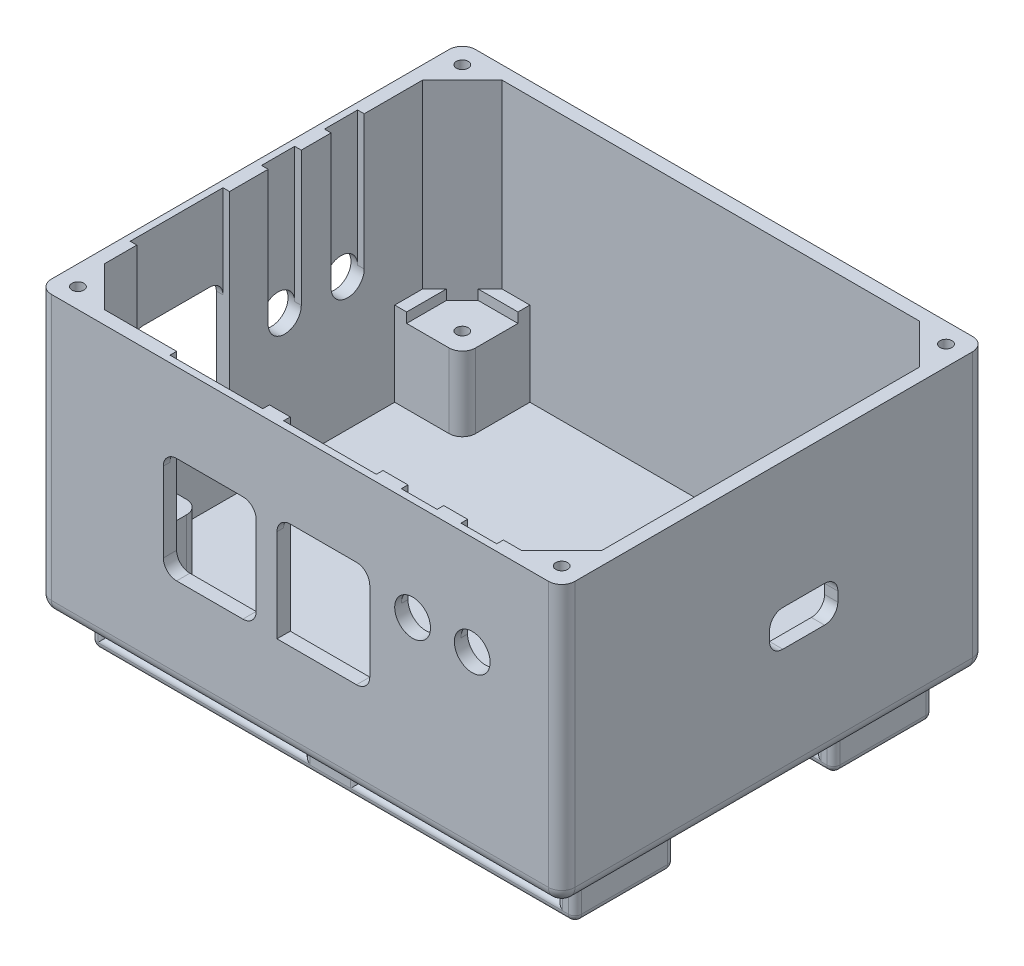
from build123d import *

# Parameters (mm, degrees)
SKETCH1_W           = 79
SKETCH1_H           = 64
BOSS_EXTRUDE1_DEPTH = 2
SKETCH2_W           = 79
SKETCH2_H           = 64
SKETCH2_W_2         = 75
SKETCH2_H_2         = 60
BOSS_EXTRUDE2_DEPTH = 40
BOSS_EXTRUDE3_DEPTH = 40
SKETCH3_R           = 0.9
CUT_EXTRUDE2_DEPTH  = 10
SKETCH5_W           = 14
SKETCH5_H           = 1
SKETCH5_W_2         = 1
SKETCH5_H_2         = 14
CUT_EXTRUDE3_DEPTH  = 28
SKETCH6_W           = 14
SKETCH6_H           = 16
CUT_EXTRUDE4_DEPTH  = 2
SKETCH7_W           = 14
SKETCH7_H           = 16
CUT_EXTRUDE5_DEPTH  = 2
CUT_EXTRUDE7_DEPTH  = 1
SKETCH10_R          = 2.5
CUT_EXTRUDE8_DEPTH  = 3
SKETCH11_R          = 2.7
CUT_EXTRUDE9_DEPTH  = 3
SKETCH12_W          = 5.4
SKETCH12_H          = 15
CUT_EXTRUDE10_DEPTH = 1
SKETCH13_W          = 10.3
SKETCH13_H          = 5.45
CUT_EXTRUDE11_DEPTH = 2
FILLET1_R           = 2
FILLET2_R           = 2
FILLET3_R           = 2
FILLET4_R           = 2
FILLET5_R           = 2
FILLET6_R           = 2
FILLET7_R           = 2
FILLET8_R           = 2
FILLET9_R           = 2
FILLET10_R          = 2
FILLET11_R          = 2
FILLET12_R          = 2
FILLET13_R          = 2
FILLET14_R          = 2
FILLET15_R          = 2
FILLET16_R          = 2
FILLET17_R          = 2
FILLET18_R          = 2
FILLET19_R          = 2
SKETCH14_W          = 10.2
SKETCH14_H          = 10.2
SKETCH14_W_2        = 9.2
BOSS_EXTRUDE5_DEPTH = 11.2
SKETCH15_R          = 0.9
CUT_EXTRUDE12_DEPTH = 10
BOSS_EXTRUDE6_DEPTH = 1.5
FILLET20_R          = 2
FILLET21_R          = 2
FILLET22_R          = 2
FILLET23_R          = 2
BOSS_EXTRUDE7_DEPTH = 6
SKETCH20_W          = 30
SKETCH20_H          = 4
CUT_EXTRUDE13_DEPTH = 58
FILLET37_R          = 1
FILLET39_R          = 1
FILLET42_R          = 1
FILLET43_R          = 1
FILLET44_R          = 1
FILLET45_R          = 1


# Some blends are built 0.0001 mm under size
with BuildPart() as part:
    # Sketch1 → Boss-Extrude1 (new body)
    with BuildSketch(Plane(origin=(0, 0, 0), x_dir=(1, 0, 0), z_dir=(0, 1, 0))):
        Rectangle(SKETCH1_W, SKETCH1_H)
    extrude(amount=BOSS_EXTRUDE1_DEPTH)

    # Sketch2 → Boss-Extrude2 (add)
    with BuildSketch(Plane(origin=(0, 2, 0), x_dir=(1, 0, 0), z_dir=(0, 1, 0))):
        Rectangle(SKETCH2_W, SKETCH2_H)
        Rectangle(SKETCH2_W_2, SKETCH2_H_2, mode=Mode.SUBTRACT)
    extrude(amount=BOSS_EXTRUDE2_DEPTH)

    # Sketch4 → Boss-Extrude3 (add)
    with BuildSketch(Plane(origin=(0, 2, 0), x_dir=(1, 0, 0), z_dir=(0, 1, 0))):
        Polygon((-37.5, 24), (-31.5, 30), (-37.5, 30), align=None)
        Polygon((37.5, 30), (37.5, 24), (31.5, 30), align=None)
        Polygon((-37.5, -30), (-37.5, -24), (-31.5, -30), align=None)
        Polygon((37.5, -30), (31.5, -30), (37.5, -24), align=None)
    extrude(amount=BOSS_EXTRUDE3_DEPTH)

    # Sketch3 → Cut-Extrude2 (cut)
    with BuildSketch(Plane(origin=(0, 42, 0), x_dir=(1, 0, 0), z_dir=(0, 1, 0))):
        with Locations(Location((-36.5, 29, 0), (0, 0, 270))):
            Circle(SKETCH3_R)
        with Locations(Location((-36.5, -29, 0), (0, 0, 270))):
            Circle(SKETCH3_R)
        with Locations(Location((36.5, -29, 0), (0, 0, 270))):
            Circle(SKETCH3_R)
        with Locations(Location((36.5, 29, 0), (0, 0, 270))):
            Circle(SKETCH3_R)
    extrude(amount=-CUT_EXTRUDE2_DEPTH, mode=Mode.SUBTRACT)

    # Sketch5 → Cut-Extrude3 (cut)
    with BuildSketch(Plane(origin=(0, 42, 0), x_dir=(1, 0, 0), z_dir=(0, 1, 0))):
        with Locations((-13.611101866, -30.5)):
            Rectangle(SKETCH5_W, SKETCH5_H)
        with Locations((3.537080368, -30.5)):
            Rectangle(SKETCH5_W, SKETCH5_H)
        with Locations((-38, -12.120628691)):
            Rectangle(SKETCH5_W_2, SKETCH5_H_2)
    extrude(amount=-CUT_EXTRUDE3_DEPTH, mode=Mode.SUBTRACT)

    # Sketch6 → Cut-Extrude4 (cut)
    with BuildSketch(Plane(origin=(0, 0, 31), x_dir=(-1, 0, 0), z_dir=(0, 0, -1))):
        with Locations((13.611101866, 22)):
            Rectangle(SKETCH6_W, SKETCH6_H)
        with Locations((-3.537080368, 22)):
            Rectangle(SKETCH6_W, SKETCH6_H)
    extrude(amount=-CUT_EXTRUDE4_DEPTH, mode=Mode.SUBTRACT)

    # Sketch7 → Cut-Extrude5 (cut)
    with BuildSketch(Plane(origin=(-38.5, 0, 0), x_dir=(0, 0, -1), z_dir=(1, 0, 0))):
        with Locations((-12.120628691, 22)):
            Rectangle(SKETCH7_W, SKETCH7_H)
    extrude(amount=-CUT_EXTRUDE5_DEPTH, mode=Mode.SUBTRACT)

    # Sketch9 → Cut-Extrude7 (cut)
    with BuildSketch(Plane(origin=(-37.5, 0, 0), x_dir=(0, 0, -1), z_dir=(1, 0, 0))):
        with BuildLine():
            Line((0.7, 21.71), (0.7, 42))
            Line((0.7, 42), (5.7, 42))
            Line((5.7, 42), (5.7, 21.71))
            ThreePointArc((5.7, 21.71), (3.2, 19.21), (0.7, 21.71))
        make_face()
        with BuildLine():
            Line((10.2, 21.71), (10.2, 42))
            Line((10.2, 42), (15.2, 42))
            Line((15.2, 42), (15.2, 21.71))
            ThreePointArc((15.2, 21.71), (12.7, 19.21), (10.2, 21.71))
        make_face()
    extrude(amount=-CUT_EXTRUDE7_DEPTH, mode=Mode.SUBTRACT)

    # Sketch10 → Cut-Extrude8 (cut)
    with BuildSketch(Plane(origin=(-38.5, 0, 0), x_dir=(0, 0, -1), z_dir=(1, 0, 0))):
        with Locations((3.2, 21.71)):
            Circle(SKETCH10_R)
        with Locations((12.7, 21.71)):
            Circle(SKETCH10_R)
    extrude(amount=-CUT_EXTRUDE8_DEPTH, mode=Mode.SUBTRACT)

    # Sketch11 → Cut-Extrude9 (cut)
    with BuildSketch(Plane.XY.offset(32)):
        with Locations((17, 27)):
            Circle(SKETCH11_R)
        with Locations((26, 27)):
            Circle(SKETCH11_R)
    extrude(amount=-CUT_EXTRUDE9_DEPTH, mode=Mode.SUBTRACT)

    # Sketch12 → Cut-Extrude10 (cut)
    with BuildSketch(Plane(origin=(0, 0, 30), x_dir=(-1, 0, 0), z_dir=(0, 0, -1))):
        with Locations((-26, 34.5)):
            Rectangle(SKETCH12_W, SKETCH12_H)
        with Locations((-17, 34.5)):
            Rectangle(SKETCH12_W, SKETCH12_H)
    extrude(amount=-CUT_EXTRUDE10_DEPTH, mode=Mode.SUBTRACT)

    # Sketch13 → Cut-Extrude11 (cut)
    with BuildSketch(Plane.ZY.offset(-37.5)):
        with Locations((-4.52, 20.165)):
            Rectangle(SKETCH13_W, SKETCH13_H)
    extrude(amount=-CUT_EXTRUDE11_DEPTH, mode=Mode.SUBTRACT)

    # Fillet1
    fillet1_edges = [part.edges().sort_by_distance(p)[0] for p in [
        (-39.5, 0, 0),
        (-39.5, 21, -32),
        (-39.5, 21, 32),
    ]]
    fillet(fillet1_edges, radius=FILLET1_R)

    # Fillet2
    fillet2_edges = [part.edges().sort_by_distance(p)[0] for p in [
        (39.5, 0, 0),
        (39.5, 21, -32),
        (39.5, 21, 32),
    ]]
    fillet(fillet2_edges, radius=FILLET2_R)

    # Fillet3
    # the kernel refuses this fillet: 2 mm, written as the material it takes off along each edge
    with BuildSketch(Plane(origin=(-37.5, 2, -30), x_dir=(0, 0, -1), z_dir=(0, -1, 0))) as fillet3_piece_1_section:
        Polygon((0, 0), (FILLET3_R, 0), (FILLET3_R, -FILLET3_R), (0, -FILLET3_R), align=None)
    fillet3_piece_1 = extrude(amount=FILLET3_R, mode=Mode.PRIVATE)
    fillet3_piece_1 = fillet3_piece_1 - Plane(origin=(-37.5, 2, -30), x_dir=(0.7071067811865475, 0, 0.7071067811865475), z_dir=(0, -1, 0)) * Sphere(FILLET3_R, mode=Mode.PRIVATE)
    add(fillet3_piece_1, mode=Mode.SUBTRACT)
    with BuildSketch(Plane(origin=(37.5, 2, -30), x_dir=(0, 0, -1), z_dir=(0, -1, 0))) as fillet3_piece_2_section:
        Polygon((0, 0), (FILLET3_R, 0), (FILLET3_R, FILLET3_R), (0, FILLET3_R), align=None)
    fillet3_piece_2 = extrude(amount=FILLET3_R, mode=Mode.PRIVATE)
    fillet3_piece_2 = fillet3_piece_2 - Plane(origin=(37.5, 2, -30), x_dir=(-0.7071067811865475, 0, 0.7071067811865476), z_dir=(0, -1, 0)) * Sphere(FILLET3_R, mode=Mode.PRIVATE)
    add(fillet3_piece_2, mode=Mode.SUBTRACT)
    with BuildSketch(Plane(origin=(-37.5, 0, -32), x_dir=(0, 0, 1), z_dir=(1, 0, 0))) as fillet3_piece_3:
        with BuildLine():
            CenterArc((FILLET3_R, -FILLET3_R), FILLET3_R, 90, 90)
            Line((0, -FILLET3_R), (0, 0))
            Line((0, 0), (FILLET3_R, 0))
        make_face()
    extrude(amount=75, mode=Mode.SUBTRACT)

    # Fillet4
    # the kernel refuses this fillet: 2 mm, written as the material it takes off along each edge
    with BuildSketch(Plane(origin=(-37.5, 2, 30), x_dir=(0, -1, 0), z_dir=(0, 0, 1))) as fillet4_piece_1_section:
        Polygon((0, 0), (FILLET4_R, 0), (FILLET4_R, -FILLET4_R), (0, -FILLET4_R), align=None)
    fillet4_piece_1 = extrude(amount=FILLET4_R, mode=Mode.PRIVATE)
    fillet4_piece_1 = fillet4_piece_1 - Plane(origin=(-37.5, 2, 30), x_dir=(0.7071067811865475, 0.7071067811865475, 0), z_dir=(0, 0, 1)) * Sphere(FILLET4_R, mode=Mode.PRIVATE)
    add(fillet4_piece_1, mode=Mode.SUBTRACT)
    with BuildSketch(Plane(origin=(37.5, 2, 30), x_dir=(0, -1, 0), z_dir=(0, 0, 1))) as fillet4_piece_2_section:
        Polygon((0, 0), (FILLET4_R, 0), (FILLET4_R, FILLET4_R), (0, FILLET4_R), align=None)
    fillet4_piece_2 = extrude(amount=FILLET4_R, mode=Mode.PRIVATE)
    fillet4_piece_2 = fillet4_piece_2 - Plane(origin=(37.5, 2, 30), x_dir=(-0.7071067811865475, 0.7071067811865475, 0), z_dir=(0, 0, 1)) * Sphere(FILLET4_R, mode=Mode.PRIVATE)
    add(fillet4_piece_2, mode=Mode.SUBTRACT)
    with BuildSketch(Plane(origin=(37.5, 0, 32), x_dir=(0, 1, 0), z_dir=(-1, 0, 0))) as fillet4_piece_3:
        with BuildLine():
            CenterArc((FILLET4_R, FILLET4_R), FILLET4_R, 180, 90)
            Line((0, FILLET4_R), (0, 0))
            Line((0, 0), (FILLET4_R, 0))
        make_face()
    extrude(amount=75, mode=Mode.SUBTRACT)

    # Fillet5
    fillet5_edges = [part.edges().sort_by_distance(p)[0] for p in [
        (-20.611101866, 14, 31),
    ]]
    fillet(fillet5_edges, radius=FILLET5_R)

    # Fillet6
    fillet6_edges = [part.edges().sort_by_distance(p)[0] for p in [
        (-6.611101866, 30, 31.5),
    ]]
    fillet(fillet6_edges, radius=FILLET6_R)

    # Fillet7
    fillet7_edges = [part.edges().sort_by_distance(p)[0] for p in [
        (-20.611101866, 30, 31.5),
    ]]
    fillet(fillet7_edges, radius=FILLET7_R)

    # Fillet8
    fillet8_edges = [part.edges().sort_by_distance(p)[0] for p in [
        (-6.611101866, 14, 31),
    ]]
    fillet(fillet8_edges, radius=FILLET8_R)

    # Fillet9
    fillet9_edges = [part.edges().sort_by_distance(p)[0] for p in [
        (-3.462919632, 30, 31.5),
    ]]
    fillet(fillet9_edges, radius=FILLET9_R)

    # Fillet10
    fillet10_edges = [part.edges().sort_by_distance(p)[0] for p in [
        (10.537080368, 30, 31.5),
    ]]
    fillet(fillet10_edges, radius=FILLET10_R)

    # Fillet11
    fillet11_edges = [part.edges().sort_by_distance(p)[0] for p in [
        (10.537080368, 14, 31),
    ]]
    fillet(fillet11_edges, radius=FILLET11_R)

    # Fillet12
    fillet12_edges = [part.edges().sort_by_distance(p)[0] for p in [
        (-38.5, 14, 5.120628691),
    ]]
    fillet(fillet12_edges, radius=FILLET12_R)

    # Fillet13
    fillet13_edges = [part.edges().sort_by_distance(p)[0] for p in [
        (-38.5, 14, 19.120628691),
    ]]
    fillet(fillet13_edges, radius=FILLET13_R)

    # Fillet14
    fillet14_edges = [part.edges().sort_by_distance(p)[0] for p in [
        (-39, 30, 19.120628691),
    ]]
    fillet(fillet14_edges, radius=FILLET14_R)

    # Fillet15
    fillet15_edges = [part.edges().sort_by_distance(p)[0] for p in [
        (-39, 30, 5.120628691),
    ]]
    fillet(fillet15_edges, radius=FILLET15_R)

    # Fillet16
    fillet16_edges = [part.edges().sort_by_distance(p)[0] for p in [
        (38.5, 17.44, -9.67),
    ]]
    fillet(fillet16_edges, radius=FILLET16_R)

    # Fillet17
    fillet17_edges = [part.edges().sort_by_distance(p)[0] for p in [
        (38.5, 22.89, 0.63),
    ]]
    fillet(fillet17_edges, radius=FILLET17_R)

    # Fillet18
    fillet18_edges = [part.edges().sort_by_distance(p)[0] for p in [
        (38.5, 22.89, -9.67),
    ]]
    fillet(fillet18_edges, radius=FILLET18_R)

    # Fillet19
    fillet19_edges = [part.edges().sort_by_distance(p)[0] for p in [
        (38.5, 17.44, 0.63),
    ]]
    fillet(fillet19_edges, radius=FILLET19_R)

    # Sketch14 → Boss-Extrude5 (add)
    with BuildSketch(Plane(origin=(0, 2, 0), x_dir=(1, 0, 0), z_dir=(0, 1, 0))):
        with Locations((-32.4, -24.9)):
            Rectangle(SKETCH14_W, SKETCH14_H)
        with Locations((-32.4, 24.9)):
            Rectangle(SKETCH14_W, SKETCH14_H)
        with Locations((32.9, -24.9)):
            Rectangle(SKETCH14_W_2, SKETCH14_H)
        with Locations((32.9, 24.9)):
            Rectangle(SKETCH14_W_2, SKETCH14_H)
    extrude(amount=BOSS_EXTRUDE5_DEPTH)

    # Sketch15 → Cut-Extrude12 (cut)
    with BuildSketch(Plane(origin=(0, 13.2, 0), x_dir=(1, 0, 0), z_dir=(0, 1, 0))):
        with Locations(Location((-30.5, -23, 0), (0, 0, 270))):
            Circle(SKETCH15_R)
        with Locations(Location((-30.5, 23, 0), (0, 0, 270))):
            Circle(SKETCH15_R)
        with Locations(Location((31.5, 23, 0), (0, 0, 270))):
            Circle(SKETCH15_R)
        with Locations(Location((31.5, -23, 0), (0, 0, 270))):
            Circle(SKETCH15_R)
    extrude(amount=-CUT_EXTRUDE12_DEPTH, mode=Mode.SUBTRACT)

    # Sketch17 → Boss-Extrude6 (add)
    with BuildSketch(Plane(origin=(0, 13.2, 0), x_dir=(1, 0, 0), z_dir=(0, 1, 0))):
        Polygon((-37.5, 24), (-35.7, 25.8), (-35.7, 19.8), (-37.5, 19.8), align=None)
        Polygon((-37.5, -19.8), (-35.7, -19.8), (-35.7, -25.8), (-37.5, -24), align=None)
        Polygon((-27.3, -30), (-31.5, -30), (-33.3, -28.2), (-27.3, -28.2), align=None)
        Polygon((-27.3, 30), (-31.5, 30), (-33.3, 28.2), (-27.3, 28.2), align=None)
        Polygon((37.5, 19.8), (36.7, 19.8), (36.7, 24.8), (37.5, 24), align=None)
        Polygon((28.3, 30), (31.5, 30), (33.3, 28.2), (28.3, 28.2), align=None)
        Polygon((28.3, -30), (31.5, -30), (33.3, -28.2), (28.3, -28.2), align=None)
        Polygon((37.5, -19.8), (36.7, -19.8), (36.7, -24.8), (37.5, -24), align=None)
    extrude(amount=BOSS_EXTRUDE6_DEPTH)

    # Fillet20
    fillet20_edges = [part.edges().sort_by_distance(p)[0] for p in [
        (-27.3, 7.6, 19.8),
    ]]
    fillet(fillet20_edges, radius=FILLET20_R)

    # Fillet21
    fillet21_edges = [part.edges().sort_by_distance(p)[0] for p in [
        (-27.3, 7.6, -19.8),
    ]]
    fillet(fillet21_edges, radius=FILLET21_R)

    # Fillet22
    fillet22_edges = [part.edges().sort_by_distance(p)[0] for p in [
        (28.3, 7.6, -19.8),
    ]]
    fillet(fillet22_edges, radius=FILLET22_R)

    # Fillet23
    fillet23_edges = [part.edges().sort_by_distance(p)[0] for p in [
        (28.3, 7.6, 19.8),
    ]]
    fillet(fillet23_edges, radius=FILLET23_R)

    # Sketch18 → Boss-Extrude7 (add)
    with BuildSketch(Plane.XZ):
        Polygon((-36.5, 27), (-2.5, 27), (2.5, 27), (36.5, 27), (36.5, 12), (2.5, 12), (-2.5, 12), (-36.5, 12), align=None)
        Polygon((-36.5, -12), (-2.5, -12), (2.5, -12), (36.5, -12), (36.5, -27), (2.5, -27), (-2.5, -27), (-36.5, -27), align=None)
    extrude(amount=BOSS_EXTRUDE7_DEPTH)

    # Sketch20 → Cut-Extrude13 (cut)
    with BuildSketch(Plane(origin=(0, 0, -27), x_dir=(-1, 0, 0), z_dir=(0, 0, -1))):
        with Locations((19.5, -2)):
            Rectangle(SKETCH20_W, SKETCH20_H)
        with Locations((-18.627998453, -2)):
            Rectangle(SKETCH20_W, SKETCH20_H)
    extrude(amount=-CUT_EXTRUDE13_DEPTH, mode=Mode.SUBTRACT)

    # Fillet37
    fillet37_edges = [part.edges().sort_by_distance(p)[0] for p in [
        (-36.5, 0, 19.5),
        (-36.5, -3, 27),
        (-35.5, 0, 12),
        (-36.5, -3, 12),
        (36.5, 0, 19.5),
        (36.5, -3, 12),
        (35.063999227, 0, 27),
        (36.5, -3, 27),
        (0, -6, 12),
        (0, -6, 27),
        (-0.436000773, 0, 27),
        (-35.5, 0, 27),
        (-0.436000773, 0, 12),
        (35.063999227, 0, 12),
        (-34.5, 0, 19.5),
        (-34.5, -2, 12),
        (-34.5, -2, 27),
        (-19.5, -4, 12),
        (-19.5, -4, 27),
        (-4.5, -2, 12),
        (-4.5, -2, 27),
        (-4.5, 0, 19.5),
        (3.627998453, 0, 19.5),
        (3.627998453, -2, 12),
        (3.627998453, -2, 27),
        (18.627998453, -4, 12),
        (18.627998453, -4, 27),
        (33.627998453, -2, 12),
        (33.627998453, -2, 27),
        (33.627998453, 0, 19.5),
    ]]
    fillet(fillet37_edges, radius=FILLET37_R - 0.0001)  # a hair under: the kernel refuses the full size

    # Fillet39
    fillet39_edges = [part.edges().sort_by_distance(p)[0] for p in [
        (33.627998453, 0, -19.5),
        (3.627998453, -2, -27),
        (33.627998453, -2, -27),
        (18.627998453, -4, -27),
        (-36.5, 0, -19.5),
        (-36.5, -3, -12),
        (-35.5, 0, -27),
        (-36.5, -3, -27),
        (36.5, 0, -19.5),
        (36.5, -3, -27),
        (35.063999227, 0, -12),
        (36.5, -3, -12),
        (0, -6, -27),
        (0, -6, -12),
        (-0.436000773, 0, -12),
        (-35.5, 0, -12),
        (33.627998453, -2, -12),
        (18.627998453, -4, -12),
        (3.627998453, -2, -12),
        (-4.5, -2, -12),
        (-19.5, -4, -12),
        (-34.5, -2, -12),
        (-0.436000773, 0, -27),
        (35.063999227, 0, -27),
        (-34.5, 0, -19.5),
        (-4.5, 0, -19.5),
        (-34.5, -2, -27),
        (-4.5, -2, -27),
        (-19.5, -4, -27),
        (3.627998453, 0, -19.5),
    ]]
    fillet(fillet39_edges, radius=FILLET39_R - 0.0001)  # a hair under: the kernel refuses the full size

    # Fillet42
    # the kernel refuses this fillet: 1 mm, written as the material it takes off along each edge
    with BuildSketch(Plane(origin=(35.5, -5, 27), x_dir=(0, -1, 0), z_dir=(-1, 0, 0))) as fillet42_piece_1:
        with BuildLine():
            CenterArc((0.0001, -0.9999), 0.9999, 0, 90)
            Line((1, -0.9999), (1, 0))
            Line((1, 0), (0.0001, 0))
        make_face()
    revolve(axis=Axis((35.5, -5, 27), (0, 0, 1)), revolution_arc=90, mode=Mode.SUBTRACT)
    with BuildSketch(Plane(origin=(35.5, -5, 12), x_dir=(1, 0, 0), z_dir=(0, 1, 0))) as fillet42_piece_2:
        with BuildLine():
            CenterArc((0.0001, -0.9999), 0.9999, 0, 90)
            Line((1, -0.9999), (1, 0))
            Line((1, 0), (0.0001, 0))
        make_face()
    revolve(axis=Axis((35.5, -5, 12), (0, 0, -1)), revolution_arc=90, mode=Mode.SUBTRACT)
    with BuildSketch(Plane(origin=(36.5, -6, 27), x_dir=(0, 1, 0), z_dir=(0, 0, -1))) as fillet42_piece_3:
        with BuildLine():
            CenterArc((FILLET42_R, -FILLET42_R), FILLET42_R, 90, 90)
            Line((0, -FILLET42_R), (0, 0))
            Line((0, 0), (FILLET42_R, 0))
        make_face()
    extrude(amount=15, mode=Mode.SUBTRACT)

    # Fillet43
    # the kernel refuses this fillet: 1 mm, written as the material it takes off along each edge
    with BuildSketch(Plane(origin=(-35.5, -5, 27), x_dir=(-1, 0, 0), z_dir=(0, 1, 0))) as fillet43_piece_1:
        with BuildLine():
            CenterArc((0.0001, -0.9999), 0.9999, 0, 90)
            Line((1, -0.9999), (1, 0))
            Line((1, 0), (0.0001, 0))
        make_face()
    revolve(axis=Axis((-35.5, -5, 27), (0, 0, 1)), revolution_arc=90, mode=Mode.SUBTRACT)
    with BuildSketch(Plane(origin=(-35.5, -5, 12), x_dir=(0, -1, 0), z_dir=(1, 0, 0))) as fillet43_piece_2:
        with BuildLine():
            CenterArc((0.0001, -0.9999), 0.9999, 0, 90)
            Line((1, -0.9999), (1, 0))
            Line((1, 0), (0.0001, 0))
        make_face()
    revolve(axis=Axis((-35.5, -5, 12), (0, 0, -1)), revolution_arc=90, mode=Mode.SUBTRACT)
    with BuildSketch(Plane(origin=(-36.5, -6, 12), x_dir=(0, 1, 0), z_dir=(0, 0, 1))) as fillet43_piece_3:
        with BuildLine():
            CenterArc((FILLET43_R, -FILLET43_R), FILLET43_R, 90, 90)
            Line((0, -FILLET43_R), (0, 0))
            Line((0, 0), (FILLET43_R, 0))
        make_face()
    extrude(amount=15, mode=Mode.SUBTRACT)

    # Fillet44
    # the kernel refuses this fillet: 1 mm, written as the material it takes off along each edge
    with BuildSketch(Plane(origin=(-35.5, -5, -12), x_dir=(-1, 0, 0), z_dir=(0, 1, 0))) as fillet44_piece_1:
        with BuildLine():
            CenterArc((0.0001, -0.9999), 0.9999, 0, 90)
            Line((1, -0.9999), (1, 0))
            Line((1, 0), (0.0001, 0))
        make_face()
    revolve(axis=Axis((-35.5, -5, -12), (0, 0, 1)), revolution_arc=90, mode=Mode.SUBTRACT)
    with BuildSketch(Plane(origin=(-35.5, -5, -27), x_dir=(0, -1, 0), z_dir=(1, 0, 0))) as fillet44_piece_2:
        with BuildLine():
            CenterArc((0.0001, -0.9999), 0.9999, 0, 90)
            Line((1, -0.9999), (1, 0))
            Line((1, 0), (0.0001, 0))
        make_face()
    revolve(axis=Axis((-35.5, -5, -27), (0, 0, -1)), revolution_arc=90, mode=Mode.SUBTRACT)
    with BuildSketch(Plane(origin=(-36.5, -6, -27), x_dir=(0, 1, 0), z_dir=(0, 0, 1))) as fillet44_piece_3:
        with BuildLine():
            CenterArc((FILLET44_R, -FILLET44_R), FILLET44_R, 90, 90)
            Line((0, -FILLET44_R), (0, 0))
            Line((0, 0), (FILLET44_R, 0))
        make_face()
    extrude(amount=15, mode=Mode.SUBTRACT)

    # Fillet45
    # the kernel refuses this fillet: 1 mm, written as the material it takes off along each edge
    with BuildSketch(Plane(origin=(35.5, -5, -12), x_dir=(0, -1, 0), z_dir=(-1, 0, 0))) as fillet45_piece_1:
        with BuildLine():
            CenterArc((0.0001, -0.9999), 0.9999, 0, 90)
            Line((1, -0.9999), (1, 0))
            Line((1, 0), (0.0001, 0))
        make_face()
    revolve(axis=Axis((35.5, -5, -12), (0, 0, 1)), revolution_arc=90, mode=Mode.SUBTRACT)
    with BuildSketch(Plane(origin=(35.5, -5, -27), x_dir=(1, 0, 0), z_dir=(0, 1, 0))) as fillet45_piece_2:
        with BuildLine():
            CenterArc((0.0001, -0.9999), 0.9999, 0, 90)
            Line((1, -0.9999), (1, 0))
            Line((1, 0), (0.0001, 0))
        make_face()
    revolve(axis=Axis((35.5, -5, -27), (0, 0, -1)), revolution_arc=90, mode=Mode.SUBTRACT)
    with BuildSketch(Plane(origin=(36.5, -6, -12), x_dir=(0, 1, 0), z_dir=(0, 0, -1))) as fillet45_piece_3:
        with BuildLine():
            CenterArc((FILLET45_R, -FILLET45_R), FILLET45_R, 90, 90)
            Line((0, -FILLET45_R), (0, 0))
            Line((0, 0), (FILLET45_R, 0))
        make_face()
    extrude(amount=15, mode=Mode.SUBTRACT)


solid = part.part
